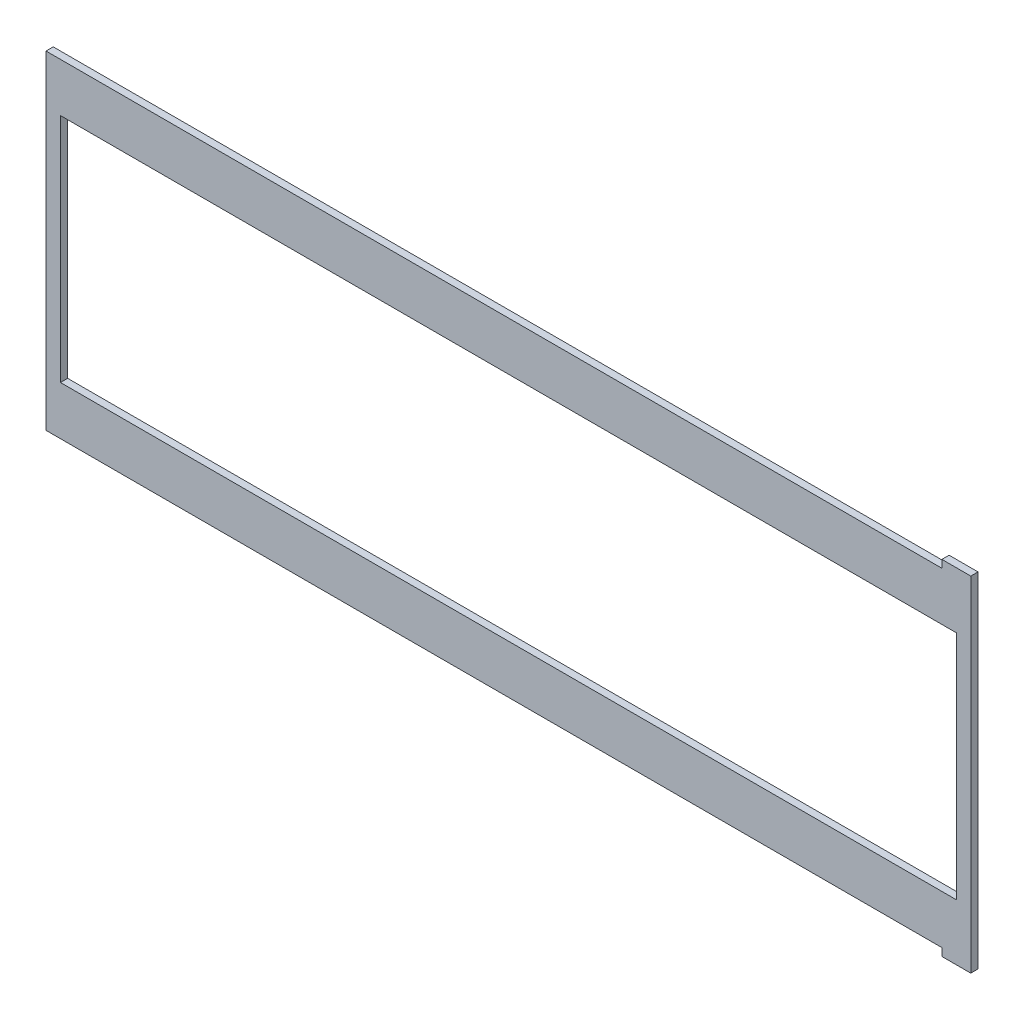
from build123d import *

# Parameters (mm, degrees)
SKETCH1_W           = 393.7
SKETCH1_H           = 101.6
BOSS_EXTRUDE1_DEPTH = 3.175


with BuildPart() as part:
    # Sketch1 → Boss-Extrude1 (new body)
    with BuildSketch(Plane.XY):
        Polygon((0, 144.3736), (0, 0), (393.7, 0), (393.7, -3.3782), (406.4, -3.3782), (406.4, 147.7518), (393.7, 147.7518), (393.7, 144.3736), align=None)
        with Locations((203.2, 72.1868)):
            Rectangle(SKETCH1_W, SKETCH1_H, mode=Mode.SUBTRACT)
    extrude(amount=BOSS_EXTRUDE1_DEPTH)


solid = part.part
